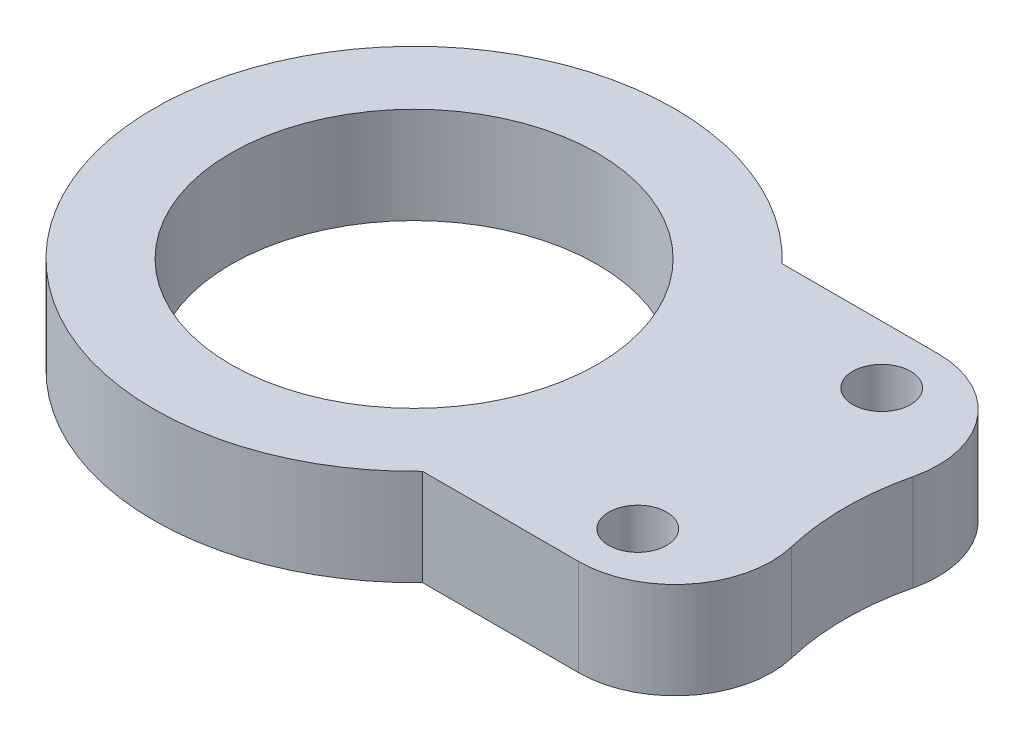
from build123d import *
from build123d.topology import SkipClean

# Parameters (mm, degrees)
SKETCH1_R           = 4.05
BOSS_EXTRUDE1_DEPTH = 5
SCALE1_SCALE        = 0.471698113
SKETCH2_R           = 1.910377358
BOSS_EXTRUDE3_DEPTH = 4.716981
SKETCH3_R           = 9.5
CUT_EXTRUDE1_DEPTH  = 35.525365892
SKETCH4_R           = 13.5
CUT_EXTRUDE2_DEPTH  = 35.525365892
SKETCH5_R           = 1.5
CUT_EXTRUDE3_DEPTH  = 35.525365892
FILLET1_R           = 5
BOSS_EXTRUDE4_START = 5
SKETCH6_R           = 9.5
SKETCH6_R_2         = 1.5
BOSS_EXTRUDE4_DEPTH = 5


with BuildPart() as part:
    # Sketch1 → Boss-Extrude1 (new, symmetric)
    with BuildSketch(Plane(origin=(0, 0, 0), x_dir=(1, 0, 0), z_dir=(0, 1, 0))):
        with BuildLine():
            Line((-38, 7.05), (38, 7.05))
            ThreePointArc((38, 7.05), (45.05, 0), (38, -7.05))
            Line((38, -7.05), (-38, -7.05))
            ThreePointArc((-38, -7.05), (-45.05, 0), (-38, 7.05))
        make_face()
        with Locations(Location((-38, 0, 0), (0, 0, 270))):
            Circle(SKETCH1_R, mode=Mode.SUBTRACT)
        with Locations(Location((38, 0, 0), (0, 0, 270))):
            Circle(SKETCH1_R, mode=Mode.SUBTRACT)
    extrude(amount=BOSS_EXTRUDE1_DEPTH, both=True)


with BuildPart() as part_1:
    # Scale1: scaled about (0, 0, 0)
    add(part.part.scale(SCALE1_SCALE))

    # Sketch2 → Boss-Extrude3 (add, through all)
    with BuildSketch(Plane(origin=(0, 2.358490566, 0), x_dir=(1, 0, 0), z_dir=(0, 1, 0))):
        with BuildLine():
            Line((8.163095128, 9.325471698), (-8.163095128, 9.325471698))
            ThreePointArc((-8.163095128, 9.325471698), (-31.424528302, 0), (-8.163095128, -9.325471698))
            Line((-8.163095128, -9.325471698), (8.163095128, -9.325471698))
            ThreePointArc((8.163095128, -9.325471698), (31.424528302, 0), (8.163095128, 9.325471698))
        make_face()
        with Locations(Location((-17.924528302, 0, 0), (0, 0, 270))):
            Circle(SKETCH2_R, mode=Mode.SUBTRACT)
        with Locations(Location((17.924528302, 0, 0), (0, 0, 270))):
            Circle(SKETCH2_R, mode=Mode.SUBTRACT)
    extrude(amount=-BOSS_EXTRUDE3_DEPTH)

    # Sketch3 → Cut-Extrude1 (cut, through all)
    with BuildSketch(Plane(origin=(0, 2.358490566, 0), x_dir=(1, 0, 0), z_dir=(0, 1, 0))):
        with Locations(Location((-17.924528302, 0, 0), (0, 0, 270))):
            Circle(SKETCH3_R)
        with Locations(Location((17.924528302, 0, 0), (0, 0, 270))):
            Circle(SKETCH3_R)
    extrude(amount=-CUT_EXTRUDE1_DEPTH, mode=Mode.SUBTRACT)

    # Sketch4 → Cut-Extrude2 (cut, through all)
    with BuildSketch(Plane(origin=(0, 2.358490566, 0), x_dir=(1, 0, 0), z_dir=(0, 1, 0))):
        with Locations((17.924528302, 0)):
            Circle(SKETCH4_R)
    extrude(amount=-CUT_EXTRUDE2_DEPTH, mode=Mode.SUBTRACT)

    # Sketch5 → Cut-Extrude3 (cut, through all)
    with BuildSketch(Plane(origin=(0, 2.358490566, 0), x_dir=(1, 0, 0), z_dir=(0, 1, 0))):
        with Locations(Location((0, 6.325471698, 0), (0, 0, 270))):
            Circle(SKETCH5_R)
        with Locations(Location((0, -6.325471698, 0), (0, 0, 270))):
            Circle(SKETCH5_R)
    extrude(amount=-CUT_EXTRUDE3_DEPTH, mode=Mode.SUBTRACT)

    # Fillet1
    # the kernel refuses this fillet: 5 mm, written as the material it takes off along each edge
    with BuildSketch(Plane(origin=(8.163095128, 22.922972313, -9.325471698), x_dir=(-0.47879135569736214, 0, 0.8779287201757795), z_dir=(0, -1, 0))) as fillet1_piece_1:
        with BuildLine():
            CenterArc((8.328082039, 4.827702878), FILLET1_R, 151.393506733, 103.521444362)
            Line((3.938438438, 7.221659656), (0, 0))
            ThreePointArc((0, 0), (3.51340961, 0.46520223), (7.02681922, 0))
        make_face()
    extrude(amount=45.845944493, mode=Mode.SUBTRACT)
    with BuildSketch(Plane(origin=(8.163095128, 22.922972313, 9.325471698), x_dir=(-1, 0, 0), z_dir=(0, -1, 0))) as fillet1_piece_2:
        with BuildLine():
            CenterArc((8.225792699, 5), FILLET1_R, 166.478555638, 103.521444362)
            ThreePointArc((3.364380301, 6.169046405), (2.090604549, 2.861788396), (0, 0))
            Line((0, 0), (8.225792699, 0))
        make_face()
    extrude(amount=45.845944493, mode=Mode.SUBTRACT)

    # Sketch6 → Boss-Extrude4 (add)
    with SkipClean():  # the faces are left unmerged after this step: merging them gives an invalid solid
        with BuildSketch(Plane(origin=(0, -2.358490566, 0), x_dir=(1, 0, 0), z_dir=(0, 1, 0)).offset(BOSS_EXTRUDE4_START)):
            with BuildLine():
                Line((-8.163095128, -9.325471698), (-0.062697571, -9.325471698))
                ThreePointArc((-0.062697571, -9.325471698), (3.864466293, -7.42020658), (4.798714827, -3.156425293))
                ThreePointArc((4.798714827, -3.156425293), (4.424528302, 0), (4.798714827, 3.156425293))
                ThreePointArc((4.798714827, 3.156425293), (3.864466293, 7.42020658), (-0.062697571, 9.325471698))
                Line((-0.062697571, 9.325471698), (-8.163095128, 9.325471698))
                ThreePointArc((-8.163095128, 9.325471698), (-31.424528302, 0), (-8.163095128, -9.325471698))
            make_face()
            with Locations(Location((-17.924528302, 0, 0), (0, 0, 270))):
                Circle(SKETCH6_R, mode=Mode.SUBTRACT)
            with Locations(Location((0, -6.325471698, 0), (0, 0, 270))):
                Circle(SKETCH6_R_2, mode=Mode.SUBTRACT)
            with Locations(Location((0, 6.325471698, 0), (0, 0, 270))):
                Circle(SKETCH6_R_2, mode=Mode.SUBTRACT)
        extrude(amount=-BOSS_EXTRUDE4_DEPTH)
    add(part_1.part.scale(1), mode=Mode.REPLACE)  # the faces are merged on a copy


solid = part_1.part
